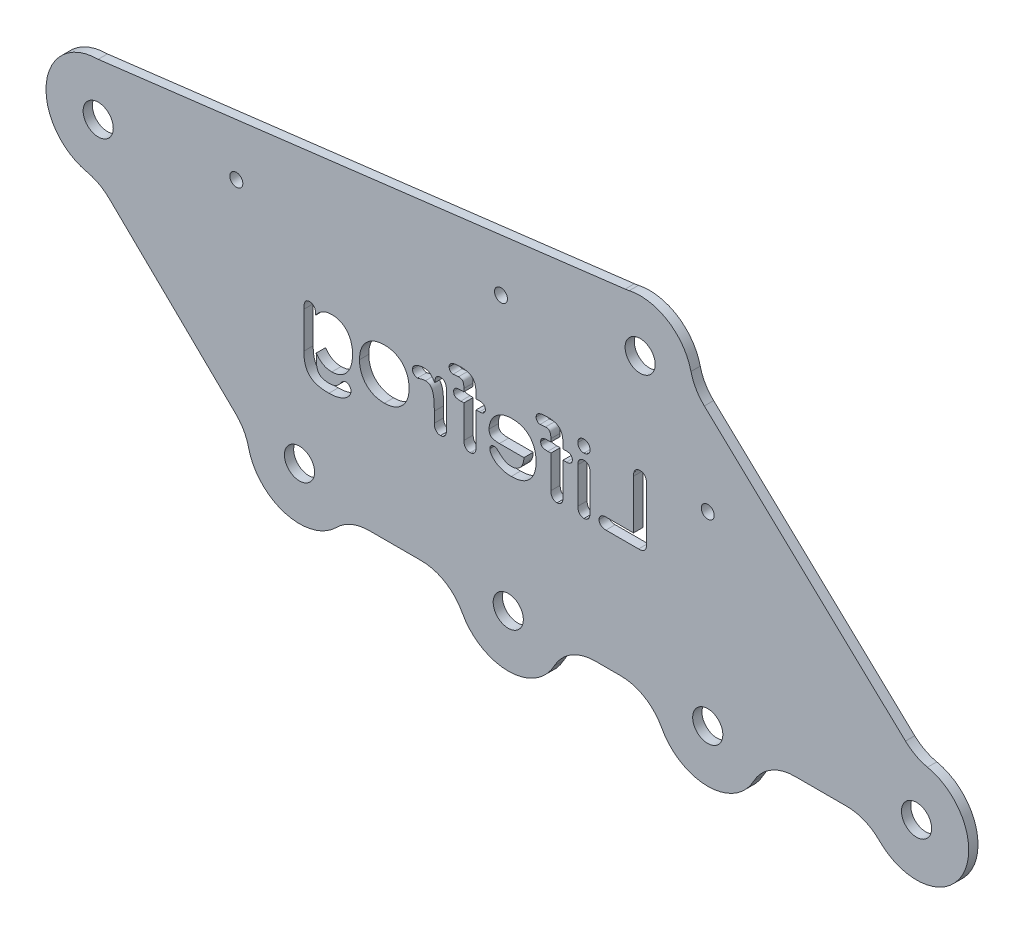
from build123d import *

# Parameters (mm, degrees)
SKETCH2_R           = 3.25
BOSS_EXTRUDE1_DEPTH = 2
SKETCH7_R           = 1.4
CUT_EXTRUDE4_DEPTH  = 173.081521917
CUT_EXTRUDE5_DEPTH  = 173.081521917
SKETCH9_R           = 4.424451358
SKETCH9_R_2         = 3.80051452
CUT_EXTRUDE6_DEPTH  = 10


with BuildPart() as part:
    # Sketch2 → Boss-Extrude1 (new body)
    with BuildSketch(Plane.XY):
        with BuildLine():
            Line((-148.073115296, -13.584682462), (-120.825231203, -40.096785488))
            ThreePointArc((-120.825231203, -40.096785488), (-119.081817876, -42.363650366), (-118.051299446, -45.031270685))
            ThreePointArc((-118.051299446, -45.031270685), (-110.186182808, -53.333696022), (-99.116582089, -50.460672154))
            ThreePointArc((-99.116582089, -50.460672154), (-95.868116105, -48.284014232), (-92.03329116, -47.519495684))
            Line((-92.03329116, -47.519495684), (-80.835284384, -47.519495684))
            ThreePointArc((-80.835284384, -47.519495684), (-75.69032683, -48.944566427), (-72.011754972, -52.813613331))
            ThreePointArc((-72.011754972, -52.813613331), (-62.085284384, -58.769495684), (-52.158813796, -52.813613331))
            ThreePointArc((-52.158813796, -52.813613331), (-48.480241938, -48.944566427), (-43.335284384, -47.519495684))
            Line((-43.335284384, -47.519495684), (-37.835284384, -47.519495684))
            ThreePointArc((-37.835284384, -47.519495684), (-32.69032683, -48.944566427), (-29.011754972, -52.813613331))
            ThreePointArc((-29.011754972, -52.813613331), (-19.085284384, -58.769495684), (-9.158813796, -52.813613331))
            ThreePointArc((-9.158813796, -52.813613331), (-5.480241938, -48.944566427), (-0.335284384, -47.519495684))
            Line((-0.335284384, -47.519495684), (10.862722393, -47.519495684))
            ThreePointArc((10.862722393, -47.519495684), (14.697547337, -48.284014232), (17.946013321, -50.460672154))
            ThreePointArc((17.946013321, -50.460672154), (35.789142951, -47.910060108), (28.284854849, -31.521998695))
            ThreePointArc((28.284854849, -31.521998695), (25.737103371, -30.597165541), (23.531291017, -29.022127188))
            Line((23.531291017, -29.022127188), (-19.826212646, 11.860344126))
            ThreePointArc((-19.826212646, 11.860344126), (-21.632423973, 14.14697339), (-22.70275091, 16.857226699))
            ThreePointArc((-22.70275091, 16.857226699), (-27.630580825, 23.793458302), (-36.00543315, 25.295678347))
            ThreePointArc((-36.00543315, 25.295678347), (-36.440399397, 25.212847446), (-36.878605966, 25.149352578))
            Line((-36.878605966, 25.149352578), (-150.472591379, 11.25))
            ThreePointArc((-150.472591379, 11.25), (-161.656466294, 1.217966296), (-152.894206081, -10.986276996))
            ThreePointArc((-152.894206081, -10.986276996), (-150.302310001, -11.949001015), (-148.073115296, -13.584682462))
        make_face()
        with Locations((25.914715616, -42.519495684)):
            Circle(SKETCH2_R, mode=Mode.SUBTRACT)
        with Locations((-19.085284384, -47.519495684)):
            Circle(SKETCH2_R, mode=Mode.SUBTRACT)
        with Locations((-62.085284384, -47.519495684)):
            Circle(SKETCH2_R, mode=Mode.SUBTRACT)
        with Locations((-107.085284384, -42.519495684)):
            Circle(SKETCH2_R, mode=Mode.SUBTRACT)
        with Locations((-150.472591379, 0)):
            Circle(SKETCH2_R, mode=Mode.SUBTRACT)
        with Locations((-33.656755, 14.29357805)):
            Circle(SKETCH2_R, mode=Mode.SUBTRACT)
    extrude(amount=BOSS_EXTRUDE1_DEPTH)

    # Sketch7 → Cut-Extrude4 (cut, through all)
    with BuildSketch(Plane.XY.offset(2)):
        with Locations((-120.694679945, 3.643623283)):
            Circle(SKETCH7_R)
        with Locations((-63.656755, 10.622780025)):
            Circle(SKETCH7_R)
        with Locations((-19.085284384, -7.519495684)):
            Circle(SKETCH7_R)
    extrude(amount=-CUT_EXTRUDE4_DEPTH, mode=Mode.SUBTRACT)

    # Sketch8 → Cut-Extrude5 (cut, through all)
    # profile 1 of 9: a face of its own
    with BuildSketch(Plane(origin=(0, 0, 0), x_dir=(-1, 0, 0), z_dir=(0, 0, -1))):
        with BuildLine():
            Line((35.086320726, -8.88917677), (35.086320726, -19.477067395))
            Line((35.086320726, -19.477067395), (41.039445726, -19.477067395))
            add(Edge.make_bspline(
                [(41.039445726, -19.477067395), (41.151207657, -19.479993195), (41.364330782, -19.485572515), (41.662298188, -19.554542719), (41.923339942, -19.661257744), (42.134401002, -19.819951832), (42.304522289, -20.005566477), (42.428077526, -20.217869304), (42.500347045, -20.454899643), (42.50877144, -20.620129964), (42.513078539, -20.704606457)],
                knots=[0, 0, 0, 0, 1.240270116, 2.365118784, 3.381765818, 4.352609133, 5.275186246, 6.165500839, 7.062084633, 8, 8, 8, 8], degree=3))
            add(Edge.make_bspline(
                [(42.513078539, -20.704606457), (42.508946769, -20.791061883), (42.500954328, -20.958300126), (42.427991131, -21.197153566), (42.305901504, -21.407864411), (42.137936653, -21.589554136), (41.927138947, -21.739731647), (41.667288952, -21.839448431), (41.367976859, -21.905877279), (41.153144472, -21.911559901), (41.039445726, -21.914567395)],
                knots=[0, 0, 0, 0, 0.961785517, 1.860465312, 2.752861249, 3.654173772, 4.599371787, 5.609990076, 6.735101654, 8, 8, 8, 8], degree=3))
            Line((41.039445726, -21.914567395), (33.996476976, -21.914567395))
            add(Edge.make_bspline(
                [(33.996476976, -21.914567395), (33.853353838, -21.910822677), (33.586803908, -21.903848583), (33.219164265, -21.820051925), (32.910084712, -21.691568649), (32.663815683, -21.496286799), (32.482305295, -21.2361672), (32.358100514, -20.915092293), (32.287886266, -20.530846545), (32.278723904, -20.25471837), (32.273820726, -20.106950207)],
                knots=[0, 0, 0, 0, 1.184943227, 2.206816713, 3.109923682, 3.939837529, 4.776053014, 5.71019795, 6.774627611, 8, 8, 8, 8], degree=3))
            Line((32.273820726, -20.106950207), (32.273820726, -8.88917677))
            add(Edge.make_bspline(
                [(32.273820726, -8.88917677), (32.277444522, -8.749162056), (32.284268854, -8.485486372), (32.356957437, -8.118037422), (32.476634418, -7.804802622), (32.645141816, -7.546892469), (32.856855173, -7.348035389), (33.099081612, -7.202614303), (33.373976884, -7.118889739), (33.566226734, -7.107793002), (33.665422289, -7.102067395)],
                knots=[0, 0, 0, 0, 1.312227502, 2.471186598, 3.495416453, 4.440711492, 5.33513045, 6.197779038, 7.0701043, 8, 8, 8, 8], degree=3))
            add(Edge.make_bspline(
                [(33.665422289, -7.102067395), (33.766728298, -7.106162598), (33.963485083, -7.114116312), (34.241681246, -7.204196573), (34.491196095, -7.34317393), (34.705487503, -7.541754535), (34.882515406, -7.795771782), (35.002902616, -8.111096688), (35.076257378, -8.481501141), (35.082815622, -8.747181708), (35.086320726, -8.88917677)],
                knots=[0, 0, 0, 0, 0.937651975, 1.821110013, 2.686129292, 3.571911612, 4.510265029, 5.535848738, 6.683015045, 8, 8, 8, 8], degree=3))
        make_face()
    # profile 2 of 9: a face of its own
    with BuildSketch(Plane(origin=(0, 0, 0), x_dir=(-1, 0, 0), z_dir=(0, 0, -1))):
        with BuildLine():
            Line((47.086320726, -12.74464552), (47.086320726, -20.476090832))
            add(Edge.make_bspline(
                [(47.086320726, -20.476090832), (47.082420593, -20.602435528), (47.075064066, -20.84074997), (47.005182236, -21.174236118), (46.88809835, -21.460321774), (46.722706311, -21.694972614), (46.519526295, -21.876468441), (46.28964053, -22.009165841), (46.031653529, -22.087195916), (45.85149376, -22.097028675), (45.759172289, -22.102067395)],
                knots=[0, 0, 0, 0, 1.279660949, 2.41372764, 3.434282009, 4.393028164, 5.297478756, 6.175532382, 7.06506577, 8, 8, 8, 8], degree=3))
            add(Edge.make_bspline(
                [(45.759172289, -22.102067395), (45.666704772, -22.097531408), (45.487838174, -22.08875712), (45.23365211, -22.004912745), (45.006451484, -21.871389965), (44.811013414, -21.682373157), (44.650959039, -21.445866625), (44.541087672, -21.160395096), (44.473171135, -20.832780478), (44.465421067, -20.599508451), (44.461320726, -20.476090832)],
                knots=[0, 0, 0, 0, 0.944656094, 1.82731652, 2.710883517, 3.62364324, 4.589202842, 5.612771424, 6.736985008, 8, 8, 8, 8], degree=3))
            Line((44.461320726, -20.476090832), (44.461320726, -12.823747082))
            add(Edge.make_bspline(
                [(44.461320726, -12.823747082), (44.4655151, -12.699382119), (44.473445887, -12.464230884), (44.539697696, -12.136087305), (44.650415089, -11.854229206), (44.811202223, -11.625466775), (45.007817757, -11.44586487), (45.234070933, -11.317596829), (45.488859368, -11.241954113), (45.666855774, -11.232151465), (45.759172289, -11.227067395)],
                knots=[0, 0, 0, 0, 1.282601348, 2.425162879, 3.437763456, 4.38569495, 5.284727511, 6.164859808, 7.048218153, 8, 8, 8, 8], degree=3))
            add(Edge.make_bspline(
                [(45.759172289, -11.227067395), (45.851434596, -11.232364163), (46.031201162, -11.242684541), (46.289294531, -11.316791228), (46.519597684, -11.446472242), (46.719799732, -11.624386887), (46.886864263, -11.846010703), (47.003355814, -12.112795725), (47.074726656, -12.416719887), (47.082335115, -12.631916842), (47.086320726, -12.74464552)],
                knots=[0, 0, 0, 0, 0.975882645, 1.901438153, 2.812865763, 3.75006033, 4.717368935, 5.725761173, 6.808663735, 8, 8, 8, 8], degree=3))
        make_face()
    # profile 3 of 9: a face of its own
    with BuildSketch(Plane(origin=(0, 0, 0), x_dir=(-1, 0, 0), z_dir=(0, 0, -1))):
        with BuildLine():
            add(Edge.make_bspline(
                [(45.788469164, -9.914567395), (45.700155278, -9.911112501), (45.527837589, -9.904371326), (45.279123369, -9.837014704), (45.05142568, -9.726888524), (44.844494731, -9.578448802), (44.672494362, -9.386651845), (44.546452039, -9.154497095), (44.472722475, -8.885778489), (44.46522284, -8.695310105), (44.461320726, -8.59620802)],
                knots=[0, 0, 0, 0, 1.006201835, 1.963296869, 2.915511555, 3.880878732, 4.85189213, 5.829536295, 6.870691953, 8, 8, 8, 8], degree=3))
            add(Edge.make_bspline(
                [(44.461320726, -8.59620802), (44.466503012, -8.504891338), (44.476546269, -8.327919822), (44.551669892, -8.073896193), (44.680826892, -7.848246813), (44.854448523, -7.652100465), (45.060826482, -7.494003153), (45.286053439, -7.371969471), (45.53257688, -7.303278473), (45.702130039, -7.29419357), (45.788469164, -7.289567395)],
                knots=[0, 0, 0, 0, 1.057408726, 2.04925565, 3.037480321, 4.047814229, 5.064214746, 6.036169889, 6.999986943, 8, 8, 8, 8], degree=3))
            add(Edge.make_bspline(
                [(45.788469164, -7.289567395), (45.871883282, -7.293289281), (46.035245133, -7.300578386), (46.272968232, -7.365176401), (46.494233713, -7.471719022), (46.696092474, -7.61868617), (46.874547315, -7.801949122), (46.996351464, -8.035133325), (47.076989401, -8.302838261), (47.083100242, -8.494958443), (47.086320726, -8.59620802)],
                knots=[0, 0, 0, 0, 0.967133894, 1.894077239, 2.837452275, 3.803721558, 4.782485793, 5.777084342, 6.828497526, 8, 8, 8, 8], degree=3))
            add(Edge.make_bspline(
                [(47.086320726, -8.59620802), (47.082548229, -8.694407685), (47.075299369, -8.883098506), (46.999769728, -9.148438196), (46.878868744, -9.381879948), (46.705206821, -9.571319036), (46.504492812, -9.722899361), (46.282136483, -9.833786351), (46.041845864, -9.904963009), (45.873933033, -9.911327839), (45.788469164, -9.914567395)],
                knots=[0, 0, 0, 0, 1.133982342, 2.178948973, 3.165031597, 4.149752721, 5.126395816, 6.06160272, 7.013399203, 8, 8, 8, 8], degree=3))
        make_face()
    # profile 4 of 9: a face of its own
    with BuildSketch(Plane(origin=(0, 0, 0), x_dir=(-1, 0, 0), z_dir=(0, 0, -1))):
        with BuildLine():
            Line((49.632219164, -11.414567395), (50.273820726, -11.414567395))
            Line((50.273820726, -11.414567395), (50.273820726, -10.591325207))
            add(Edge.make_bspline(
                [(50.273820726, -10.591325207), (50.277514056, -10.388045332), (50.284509589, -10.00301306), (50.342549558, -9.457909943), (50.436641901, -8.978381027), (50.569332837, -8.557808501), (50.755633772, -8.195572563), (50.996610195, -7.887535194), (51.293777818, -7.633608774), (51.648730133, -7.431434885), (52.067068931, -7.280410479), (52.552532894, -7.174729198), (53.108091552, -7.111487828), (53.502156344, -7.105323868), (53.710344164, -7.102067395)],
                knots=[0, 0, 0, 0, 1.272338929, 2.409936283, 3.426662608, 4.327577154, 5.161578725, 5.96266415, 6.760383261, 7.592994418, 8.506024445, 9.533847079, 10.697110196, 12, 12, 12, 12], degree=3))
            add(Edge.make_bspline(
                [(53.710344164, -7.102067395), (53.895146779, -7.104261268), (54.241413904, -7.108371958), (54.723647309, -7.168286024), (55.135762658, -7.255167266), (55.473032061, -7.391161667), (55.744889456, -7.558653085), (55.937764712, -7.776533401), (56.05427242, -8.037027657), (56.067659952, -8.223910447), (56.074601976, -8.320817395)],
                knots=[0, 0, 0, 0, 1.495564663, 2.802259462, 3.930374803, 4.895312065, 5.735498063, 6.492167842, 7.218122695, 8, 8, 8, 8], degree=3))
            add(Edge.make_bspline(
                [(56.074601976, -8.320817395), (56.07205453, -8.384563693), (56.067042815, -8.509974928), (56.019565864, -8.690669099), (55.937272087, -8.855101057), (55.831089458, -9.002344218), (55.703605103, -9.125761707), (55.560931421, -9.215318606), (55.405925119, -9.272564588), (55.297752865, -9.278650351), (55.242570726, -9.281754895)],
                knots=[0, 0, 0, 0, 1.08569999, 2.135951137, 3.156332465, 4.20565892, 5.218674748, 6.161348951, 7.062045096, 8, 8, 8, 8], degree=3))
            add(Edge.make_bspline(
                [(55.242570726, -9.281754895), (55.211291096, -9.281243662), (55.139763808, -9.280074624), (55.017892004, -9.265550853), (54.867145158, -9.249871502), (54.639618335, -9.213428957), (54.363834674, -9.175272517), (54.14601204, -9.167906783), (54.047258226, -9.164567395)],
                knots=[0, 0, 0, 0, 0.468218035, 1.070676523, 1.83620524, 2.737967929, 4.521099009, 6, 6, 6, 6], degree=3))
            add(Edge.make_bspline(
                [(54.047258226, -9.164567395), (53.935335203, -9.168513751), (53.730509601, -9.175735811), (53.453388449, -9.253609551), (53.236438618, -9.387787922), (53.093840565, -9.587280743), (53.00705741, -9.82836939), (52.94477266, -10.108223991), (52.902635068, -10.432859402), (52.900145328, -10.66441903), (52.898820726, -10.78761427)],
                knots=[0, 0, 0, 0, 1.158634456, 2.120368021, 2.955008234, 3.751380872, 4.611223429, 5.599229928, 6.722733105, 8, 8, 8, 8], degree=3))
            Line((52.898820726, -10.78761427), (52.898820726, -11.414567395))
            Line((52.898820726, -11.414567395), (53.563859789, -11.414567395))
            add(Edge.make_bspline(
                [(53.563859789, -11.414567395), (53.684179087, -11.416649074), (53.910242779, -11.420560268), (54.225792592, -11.467875581), (54.49621768, -11.540251074), (54.718209635, -11.648680399), (54.893566863, -11.789413733), (55.016660753, -11.965226471), (55.094330745, -12.172143548), (55.10125483, -12.32106946), (55.104875414, -12.398942395)],
                knots=[0, 0, 0, 0, 1.396050608, 2.622990337, 3.6962846, 4.634546857, 5.472373731, 6.277878481, 7.09950757, 8, 8, 8, 8], degree=3))
            add(Edge.make_bspline(
                [(55.104875414, -12.398942395), (55.100784732, -12.506003658), (55.0933337, -12.701011923), (55.017531846, -12.965095468), (54.888175636, -13.171513058), (54.692271136, -13.302589493), (54.461307669, -13.37783369), (54.196374468, -13.437731598), (53.892808985, -13.470942071), (53.677213775, -13.474956644), (53.563859789, -13.477067395)],
                knots=[0, 0, 0, 0, 1.171181197, 2.133264703, 2.982673099, 3.781862637, 4.659228062, 5.636037739, 6.757094158, 8, 8, 8, 8], degree=3))
            Line((53.563859789, -13.477067395), (52.898820726, -13.477067395))
            Line((52.898820726, -13.477067395), (52.898820726, -20.49073927))
            add(Edge.make_bspline(
                [(52.898820726, -20.49073927), (52.894890647, -20.614179922), (52.887425469, -20.848655192), (52.816934516, -21.176561155), (52.703366177, -21.461585314), (52.538062875, -21.695052259), (52.335369862, -21.875428653), (52.106713482, -22.010618694), (51.846897908, -22.086940159), (51.664920121, -22.096942211), (51.571672289, -22.102067395)],
                knots=[0, 0, 0, 0, 1.256538349, 2.386792053, 3.399650087, 4.363398215, 5.272567509, 6.146574889, 7.050280375, 8, 8, 8, 8], degree=3))
            add(Edge.make_bspline(
                [(51.571672289, -22.102067395), (51.482224977, -22.09710813), (51.307699782, -22.087431855), (51.057160741, -22.007724342), (50.831657988, -21.876461922), (50.631448396, -21.694722042), (50.469647741, -21.460721404), (50.355528177, -21.176665365), (50.285268804, -20.8486244), (50.277769023, -20.614169302), (50.273820726, -20.49073927)],
                knots=[0, 0, 0, 0, 0.920542794, 1.796117823, 2.680158831, 3.592296685, 4.561321835, 5.585807508, 6.729036556, 8, 8, 8, 8], degree=3))
            Line((50.273820726, -20.49073927), (50.273820726, -13.477067395))
            Line((50.273820726, -13.477067395), (49.532609789, -13.477067395))
            add(Edge.make_bspline(
                [(49.532609789, -13.477067395), (49.437497333, -13.474545828), (49.257144996, -13.469764431), (49.004612129, -13.411306638), (48.782055088, -13.326305771), (48.598641031, -13.197615767), (48.451306666, -13.041843238), (48.352045043, -12.858126156), (48.285842232, -12.656347119), (48.279207657, -12.513757181), (48.275773851, -12.43995802)],
                knots=[0, 0, 0, 0, 1.239726906, 2.350771435, 3.369360947, 4.331849643, 5.252604265, 6.143447782, 7.039118766, 8, 8, 8, 8], degree=3))
            add(Edge.make_bspline(
                [(48.275773851, -12.43995802), (48.278931014, -12.359364997), (48.28493967, -12.205981751), (48.351465421, -11.99217143), (48.459813646, -11.809230275), (48.613188222, -11.659732473), (48.810357544, -11.547566221), (49.047458479, -11.470404208), (49.325403123, -11.419710271), (49.525517403, -11.416355939), (49.632219164, -11.414567395)],
                knots=[0, 0, 0, 0, 0.995382564, 1.894394861, 2.740686784, 3.604514537, 4.515167111, 5.524921804, 6.68027808, 8, 8, 8, 8], degree=3))
        make_face()
    # profile 5 of 9: a face of its own
    with BuildSketch(Plane(origin=(0, 0, 0), x_dir=(-1, 0, 0), z_dir=(0, 0, -1))):
        with BuildLine():
            Line((63.993547289, -17.227067395), (58.711320726, -17.227067395))
            add(Edge.make_bspline(
                [(58.711320726, -17.227067395), (58.716485938, -17.373895282), (58.726607174, -17.661604604), (58.802714884, -18.07799563), (58.915860462, -18.469071713), (59.073647335, -18.829619398), (59.270554735, -19.153364248), (59.492765404, -19.442705533), (59.750507136, -19.684973297), (60.03645821, -19.88267243), (60.345770403, -20.033615445), (60.670482904, -20.148105778), (61.01253608, -20.212156224), (61.245255038, -20.222066531), (61.362687914, -20.227067395)],
                knots=[0, 0, 0, 0, 1.179639705, 2.311504614, 3.392005435, 4.44652888, 5.46432702, 6.431680492, 7.370191764, 8.295643874, 9.215452015, 10.129041871, 11.055891293, 12, 12, 12, 12], degree=3))
            add(Edge.make_bspline(
                [(61.362687914, -20.227067395), (61.517315025, -20.221290078), (61.81522082, -20.210159454), (62.248320892, -20.128402077), (62.65037596, -19.976572402), (63.029981243, -19.770423211), (63.382588562, -19.521193305), (63.667016112, -19.296133613), (63.89432751, -19.094787244), (64.085795058, -18.918875484), (64.304668367, -18.722900775), (64.455732274, -18.581855292), (64.535539476, -18.507340832)],
                knots=[0, 0, 0, 0, 1.247905556, 2.404224554, 3.538983975, 4.702801183, 5.881313568, 7.020008393, 7.628790321, 8.331868978, 9.11872483, 10, 10, 10, 10], degree=3))
            add(Edge.make_bspline(
                [(64.535539476, -18.507340832), (64.572653698, -18.48027204), (64.649909263, -18.423926662), (64.791469612, -18.369543996), (64.954050743, -18.338198915), (65.069560502, -18.333846809), (65.130266039, -18.331559582)],
                knots=[0, 0, 0, 0, 0.868866131, 1.808598965, 2.848320883, 4, 4, 4, 4], degree=3))
            add(Edge.make_bspline(
                [(65.130266039, -18.331559582), (65.197009882, -18.333900139), (65.324294385, -18.33836372), (65.504066974, -18.385198991), (65.666679189, -18.453914722), (65.804779268, -18.559309462), (65.921073021, -18.686697731), (66.001439392, -18.843467551), (66.053282091, -19.021621344), (66.057023071, -19.149522649), (66.058976976, -19.216325207)],
                knots=[0, 0, 0, 0, 1.102465736, 2.102468148, 3.057950005, 4.00546365, 4.956145095, 5.889200524, 6.897534264, 8, 8, 8, 8], degree=3))
            add(Edge.make_bspline(
                [(66.058976976, -19.216325207), (66.055140543, -19.281058441), (66.047007822, -19.418284177), (65.990684139, -19.630580971), (65.89753, -19.856403047), (65.771680317, -20.095129398), (65.612344825, -20.341196211), (65.409653802, -20.580823639), (65.174931597, -20.819411181), (64.902221637, -21.049528185), (64.595344086, -21.269822809), (64.249335099, -21.470546591), (63.864239991, -21.646257285), (63.446257949, -21.809324299), (62.992864569, -21.941257019), (62.504327356, -22.0333954), (61.984342492, -22.094193404), (61.625563625, -22.099400308), (61.441789476, -22.102067395)],
                knots=[0, 0, 0, 0, 0.525537938, 1.114069654, 1.772306998, 2.506549159, 3.302753817, 4.147512317, 5.050313588, 6.017967943, 7.041213872, 8.114344659, 9.260276936, 10.47524946, 11.755151616, 13.087980653, 14.508401902, 16, 16, 16, 16], degree=3))
            add(Edge.make_bspline(
                [(61.441789476, -22.102067395), (61.231648736, -22.097519737), (60.821964685, -22.088653761), (60.226784289, -22.021353682), (59.669210967, -21.908362258), (59.150569744, -21.745772772), (58.667513306, -21.542562166), (58.224053508, -21.288395048), (57.820679107, -20.987522623), (57.455460166, -20.64373407), (57.134442572, -20.257975864), (56.850340149, -19.841633038), (56.616330833, -19.388813691), (56.421842234, -18.905299727), (56.270116103, -18.389217889), (56.162139879, -17.840151988), (56.09676424, -17.258936562), (56.089857706, -16.86005426), (56.086320726, -16.655778332)],
                knots=[0, 0, 0, 0, 1.161895415, 2.265196273, 3.307380836, 4.303185105, 5.266158709, 6.199917451, 7.122316156, 8.043005893, 8.966794753, 9.89246016, 10.824859252, 11.779559524, 12.770652002, 13.794812853, 14.87067777, 16, 16, 16, 16], degree=3))
            add(Edge.make_bspline(
                [(56.086320726, -16.655778332), (56.089863596, -16.462226663), (56.096844531, -16.080848933), (56.163955879, -15.519624607), (56.268451373, -14.979723953), (56.413728423, -14.462108781), (56.604168314, -13.975533109), (56.829293377, -13.519340339), (57.098097208, -13.102077052), (57.402287332, -12.718106315), (57.750981266, -12.376213514), (58.140980683, -12.074737303), (58.573216423, -11.817183613), (59.045085371, -11.603132446), (59.551427203, -11.433045112), (60.089833345, -11.315293392), (60.656383848, -11.238702527), (61.044069017, -11.231007425), (61.242570726, -11.227067395)],
                knots=[0, 0, 0, 0, 1.095507523, 2.15860795, 3.195309999, 4.206995944, 5.197887526, 6.149926361, 7.082497361, 8.003040645, 8.917987058, 9.840388418, 10.787726911, 11.760164811, 12.769081724, 13.806049167, 14.876658106, 16, 16, 16, 16], degree=3))
            add(Edge.make_bspline(
                [(61.242570726, -11.227067395), (61.372538981, -11.22810589), (61.627045231, -11.23013949), (62.001408011, -11.265268194), (62.362503375, -11.313850777), (62.710727077, -11.382379075), (63.04253843, -11.478141357), (63.361054388, -11.589179566), (63.666118712, -11.720379466), (63.955121946, -11.874248291), (64.230989577, -12.038773815), (64.485024674, -12.223475089), (64.726773861, -12.411434191), (64.947774364, -12.616494045), (65.15303199, -12.831425773), (65.33677691, -13.06140635), (65.506460871, -13.299708893), (65.701149201, -13.632045496), (65.90499798, -14.058699678), (66.086744263, -14.582630241), (66.196585792, -15.115069491), (66.210329972, -15.472667779), (66.217180101, -15.65089552)],
                knots=[0, 0, 0, 0, 1.048847282, 2.053872234, 3.03283051, 3.989924751, 4.915857681, 5.818505585, 6.711913066, 7.593554535, 8.460263899, 9.302531452, 10.127499996, 10.930978608, 11.734070318, 12.524563272, 13.305443929, 14.093732096, 15.631266151, 17.114748765, 18.561984696, 20, 20, 20, 20], degree=3))
            add(Edge.make_bspline(
                [(66.217180101, -15.65089552), (66.215610952, -15.730068621), (66.212617901, -15.881086234), (66.186937014, -16.097314554), (66.140772023, -16.291180146), (66.075053252, -16.464024902), (65.995488051, -16.617172785), (65.89278487, -16.74579461), (65.773975455, -16.854326494), (65.582181996, -16.968584464), (65.300769745, -17.07492862), (64.916543956, -17.164445981), (64.474589043, -17.219117531), (64.159728488, -17.224321026), (63.993547289, -17.227067395)],
                knots=[0, 0, 0, 0, 0.899856074, 1.716417764, 2.470354694, 3.159019517, 3.814679391, 4.423252287, 5.02068589, 5.633798556, 6.949059873, 8.421953477, 10.111532063, 12, 12, 12, 12], degree=3))
        make_face()
        with BuildLine():
            Line((58.711320726, -15.727067395), (63.606828539, -15.727067395))
            add(Edge.make_bspline(
                [(63.606828539, -15.727067395), (63.597892017, -15.620388862), (63.580506578, -15.412852503), (63.525243597, -15.113999216), (63.460289426, -14.835108466), (63.374142884, -14.577543089), (63.272543011, -14.341165405), (63.154505162, -14.123236857), (63.017386306, -13.928050969), (62.863841728, -13.753386376), (62.694974951, -13.600302554), (62.514511391, -13.465060191), (62.318539721, -13.352382039), (62.109343802, -13.262997606), (61.88971522, -13.187447347), (61.65522259, -13.140138129), (61.409640164, -13.105158478), (61.240753138, -13.103110926), (61.154680101, -13.102067395)],
                knots=[0, 0, 0, 0, 1.274652096, 2.479755284, 3.617009281, 4.684005428, 5.71065458, 6.679155714, 7.63137599, 8.546404667, 9.444107911, 10.342338794, 11.228430864, 12.129821099, 13.049645363, 13.989847955, 14.975528821, 16, 16, 16, 16], degree=3))
            add(Edge.make_bspline(
                [(61.154680101, -13.102067395), (61.072577515, -13.10475237), (60.911762666, -13.110011447), (60.674960792, -13.138599654), (60.450175128, -13.191199261), (60.236485897, -13.265652746), (60.033877273, -13.359118289), (59.842432731, -13.474146939), (59.662756958, -13.609700616), (59.495375907, -13.766189336), (59.339368932, -13.941320054), (59.201880517, -14.138573533), (59.081832188, -14.355594311), (58.972348183, -14.589561112), (58.881951346, -14.845787112), (58.809840485, -15.122470817), (58.750931011, -15.417941176), (58.724734593, -15.622383021), (58.711320726, -15.727067395)],
                knots=[0, 0, 0, 0, 0.988988761, 1.937138454, 2.867098831, 3.763434994, 4.657917626, 5.549380048, 6.447873833, 7.363218941, 8.304708192, 9.267190604, 10.251834605, 11.288414524, 12.374576878, 13.518478699, 14.729337904, 16, 16, 16, 16], degree=3))
        make_face(mode=Mode.SUBTRACT)
    # profile 6 of 9: a face of its own
    with BuildSketch(Plane(origin=(0, 0, 0), x_dir=(-1, 0, 0), z_dir=(0, 0, -1))):
        with BuildLine():
            Line((68.382219164, -11.414567395), (69.023820726, -11.414567395))
            Line((69.023820726, -11.414567395), (69.023820726, -10.591325207))
            add(Edge.make_bspline(
                [(69.023820726, -10.591325207), (69.027514056, -10.388045332), (69.034509589, -10.00301306), (69.092549558, -9.457909943), (69.186641901, -8.978381027), (69.319332837, -8.557808501), (69.505633772, -8.195572563), (69.746610195, -7.887535194), (70.043777818, -7.633608774), (70.398730133, -7.431434885), (70.817068931, -7.280410479), (71.302532894, -7.174729198), (71.858091552, -7.111487828), (72.252156344, -7.105323868), (72.460344164, -7.102067395)],
                knots=[0, 0, 0, 0, 1.272338929, 2.409936283, 3.426662608, 4.327577154, 5.161578725, 5.96266415, 6.760383261, 7.592994418, 8.506024445, 9.533847079, 10.697110196, 12, 12, 12, 12], degree=3))
            add(Edge.make_bspline(
                [(72.460344164, -7.102067395), (72.645146779, -7.104261268), (72.991413904, -7.108371958), (73.473647309, -7.168286024), (73.885762658, -7.255167266), (74.223032061, -7.391161667), (74.494889456, -7.558653085), (74.687764712, -7.776533401), (74.80427242, -8.037027657), (74.817659952, -8.223910447), (74.824601976, -8.320817395)],
                knots=[0, 0, 0, 0, 1.495564663, 2.802259462, 3.930374803, 4.895312065, 5.735498063, 6.492167842, 7.218122695, 8, 8, 8, 8], degree=3))
            add(Edge.make_bspline(
                [(74.824601976, -8.320817395), (74.82205453, -8.384563693), (74.817042815, -8.509974928), (74.769565864, -8.690669099), (74.687272087, -8.855101057), (74.581089458, -9.002344218), (74.453605103, -9.125761707), (74.310931421, -9.215318606), (74.155925119, -9.272564588), (74.047752865, -9.278650351), (73.992570726, -9.281754895)],
                knots=[0, 0, 0, 0, 1.08569999, 2.135951137, 3.156332465, 4.20565892, 5.218674748, 6.161348951, 7.062045096, 8, 8, 8, 8], degree=3))
            add(Edge.make_bspline(
                [(73.992570726, -9.281754895), (73.961291096, -9.281243662), (73.889763808, -9.280074624), (73.767892004, -9.265550853), (73.617145158, -9.249871502), (73.389618335, -9.213428957), (73.113834674, -9.175272517), (72.89601204, -9.167906783), (72.797258226, -9.164567395)],
                knots=[0, 0, 0, 0, 0.468218035, 1.070676523, 1.83620524, 2.737967929, 4.521099009, 6, 6, 6, 6], degree=3))
            add(Edge.make_bspline(
                [(72.797258226, -9.164567395), (72.685335203, -9.168513751), (72.480509601, -9.175735811), (72.203388449, -9.253609551), (71.986438618, -9.387787922), (71.843840565, -9.587280743), (71.75705741, -9.82836939), (71.69477266, -10.108223991), (71.652635068, -10.432859402), (71.650145328, -10.66441903), (71.648820726, -10.78761427)],
                knots=[0, 0, 0, 0, 1.158634456, 2.120368021, 2.955008234, 3.751380872, 4.611223429, 5.599229928, 6.722733105, 8, 8, 8, 8], degree=3))
            Line((71.648820726, -10.78761427), (71.648820726, -11.414567395))
            Line((71.648820726, -11.414567395), (72.313859789, -11.414567395))
            add(Edge.make_bspline(
                [(72.313859789, -11.414567395), (72.434179087, -11.416649074), (72.660242779, -11.420560268), (72.975792592, -11.467875581), (73.24621768, -11.540251074), (73.468209635, -11.648680399), (73.643566863, -11.789413733), (73.766660753, -11.965226471), (73.844330745, -12.172143548), (73.85125483, -12.32106946), (73.854875414, -12.398942395)],
                knots=[0, 0, 0, 0, 1.396050608, 2.622990337, 3.6962846, 4.634546857, 5.472373731, 6.277878481, 7.09950757, 8, 8, 8, 8], degree=3))
            add(Edge.make_bspline(
                [(73.854875414, -12.398942395), (73.850784732, -12.506003658), (73.8433337, -12.701011923), (73.767531846, -12.965095468), (73.638175636, -13.171513058), (73.442271136, -13.302589493), (73.211307669, -13.37783369), (72.946374468, -13.437731598), (72.642808985, -13.470942071), (72.427213775, -13.474956644), (72.313859789, -13.477067395)],
                knots=[0, 0, 0, 0, 1.171181197, 2.133264703, 2.982673099, 3.781862637, 4.659228062, 5.636037739, 6.757094158, 8, 8, 8, 8], degree=3))
            Line((72.313859789, -13.477067395), (71.648820726, -13.477067395))
            Line((71.648820726, -13.477067395), (71.648820726, -20.49073927))
            add(Edge.make_bspline(
                [(71.648820726, -20.49073927), (71.644890647, -20.614179922), (71.637425469, -20.848655192), (71.566934516, -21.176561155), (71.453366177, -21.461585314), (71.288062875, -21.695052259), (71.085369862, -21.875428653), (70.856713482, -22.010618694), (70.596897908, -22.086940159), (70.414920121, -22.096942211), (70.321672289, -22.102067395)],
                knots=[0, 0, 0, 0, 1.256538349, 2.386792053, 3.399650087, 4.363398215, 5.272567509, 6.146574889, 7.050280375, 8, 8, 8, 8], degree=3))
            add(Edge.make_bspline(
                [(70.321672289, -22.102067395), (70.232224977, -22.09710813), (70.057699782, -22.087431855), (69.807160741, -22.007724342), (69.581657988, -21.876461922), (69.381448396, -21.694722042), (69.219647741, -21.460721404), (69.105528177, -21.176665365), (69.035268804, -20.8486244), (69.027769023, -20.614169302), (69.023820726, -20.49073927)],
                knots=[0, 0, 0, 0, 0.920542794, 1.796117823, 2.680158831, 3.592296685, 4.561321835, 5.585807508, 6.729036556, 8, 8, 8, 8], degree=3))
            Line((69.023820726, -20.49073927), (69.023820726, -13.477067395))
            Line((69.023820726, -13.477067395), (68.282609789, -13.477067395))
            add(Edge.make_bspline(
                [(68.282609789, -13.477067395), (68.187497333, -13.474545828), (68.007144996, -13.469764431), (67.754612129, -13.411306638), (67.532055088, -13.326305771), (67.348641031, -13.197615767), (67.201306666, -13.041843238), (67.102045043, -12.858126156), (67.035842232, -12.656347119), (67.029207657, -12.513757181), (67.025773851, -12.43995802)],
                knots=[0, 0, 0, 0, 1.239726906, 2.350771435, 3.369360947, 4.331849643, 5.252604265, 6.143447782, 7.039118766, 8, 8, 8, 8], degree=3))
            add(Edge.make_bspline(
                [(67.025773851, -12.43995802), (67.028931014, -12.359364997), (67.03493967, -12.205981751), (67.101465421, -11.99217143), (67.209813646, -11.809230275), (67.363188222, -11.659732473), (67.560357544, -11.547566221), (67.797458479, -11.470404208), (68.075403123, -11.419710271), (68.275517403, -11.416355939), (68.382219164, -11.414567395)],
                knots=[0, 0, 0, 0, 0.995382564, 1.894394861, 2.740686784, 3.604514537, 4.515167111, 5.524921804, 6.68027808, 8, 8, 8, 8], degree=3))
        make_face()
    # profile 7 of 9: a face of its own
    with BuildSketch(Plane(origin=(0, 0, 0), x_dir=(-1, 0, 0), z_dir=(0, 0, -1))):
        with BuildLine():
            Line((78.023820726, -18.21730177), (78.023820726, -20.464372082))
            add(Edge.make_bspline(
                [(78.023820726, -20.464372082), (78.019892411, -20.592663462), (78.012477123, -20.83483283), (77.942998305, -21.173173015), (77.826395379, -21.46268977), (77.660008013, -21.697626109), (77.457891862, -21.879946249), (77.226225762, -22.008518529), (76.969273636, -22.08740627), (76.789034454, -22.097099946), (76.696672289, -22.102067395)],
                knots=[0, 0, 0, 0, 1.292414504, 2.439627698, 3.46375878, 4.417332263, 5.316903122, 6.185375834, 7.070109971, 8, 8, 8, 8], degree=3))
            add(Edge.make_bspline(
                [(76.696672289, -22.102067395), (76.605316881, -22.09710505), (76.427986301, -22.087472609), (76.174585021, -22.009227395), (75.950610673, -21.875274697), (75.750230464, -21.695716107), (75.591715438, -21.458957778), (75.476710712, -21.174115576), (75.410996302, -20.840355995), (75.403041563, -20.602368539), (75.398820726, -20.476090832)],
                knots=[0, 0, 0, 0, 0.933294383, 1.81162385, 2.680186499, 3.585258456, 4.541104918, 5.566887721, 6.708974649, 8, 8, 8, 8], degree=3))
            Line((75.398820726, -20.476090832), (75.398820726, -13.028825207))
            add(Edge.make_bspline(
                [(75.398820726, -13.028825207), (75.402484719, -12.887967816), (75.409365917, -12.623429237), (75.466438734, -12.253599122), (75.562647251, -11.937580399), (75.705960969, -11.678454634), (75.886700953, -11.470839169), (76.115388002, -11.325648529), (76.384574397, -11.24325969), (76.575973652, -11.232631094), (76.676164476, -11.227067395)],
                knots=[0, 0, 0, 0, 1.34619872, 2.528241455, 3.567694465, 4.487339067, 5.340335725, 6.171799567, 7.043000931, 8, 8, 8, 8], degree=3))
            add(Edge.make_bspline(
                [(76.676164476, -11.227067395), (76.778250892, -11.23166171), (76.970074096, -11.240294554), (77.23647969, -11.31618665), (77.457457209, -11.448839438), (77.627712083, -11.63900255), (77.758010721, -11.876050227), (77.852605586, -12.159893812), (77.912208923, -12.492418163), (77.927694018, -12.729745798), (77.935930101, -12.855973645)],
                knots=[0, 0, 0, 0, 1.044883286, 1.963364657, 2.807970932, 3.650974255, 4.547373518, 5.563477854, 6.704082887, 8, 8, 8, 8], degree=3))
            add(Edge.make_bspline(
                [(77.935930101, -12.855973645), (78.015060213, -12.728702257), (78.166410553, -12.485273209), (78.414258837, -12.155879517), (78.661252631, -11.872664951), (78.918064986, -11.635812705), (79.199992654, -11.445181426), (79.525823034, -11.317799074), (79.892305657, -11.240889927), (80.150364302, -11.231818927), (80.285539476, -11.227067395)],
                knots=[0, 0, 0, 0, 1.18924255, 2.274636787, 3.268721947, 4.168850259, 5.041860026, 5.953170485, 6.927838526, 8, 8, 8, 8], degree=3))
            add(Edge.make_bspline(
                [(80.285539476, -11.227067395), (80.426467245, -11.232489358), (80.70936151, -11.243373249), (81.129162593, -11.320929872), (81.541294315, -11.453132582), (81.873448057, -11.600397905), (82.12154417, -11.742608322), (82.286513298, -11.857020394), (82.423463313, -11.98382965), (82.540429583, -12.115426572), (82.630091374, -12.257833616), (82.691453181, -12.409798496), (82.732078243, -12.569674136), (82.735800435, -12.679941298), (82.737687914, -12.735856457)],
                knots=[0, 0, 0, 0, 1.609451603, 3.230765888, 4.857137694, 6.544750347, 7.369389467, 8.121503283, 8.832102741, 9.496362917, 10.127778221, 10.743023735, 11.362602371, 12, 12, 12, 12], degree=3))
            add(Edge.make_bspline(
                [(82.737687914, -12.735856457), (82.734447601, -12.813574254), (82.728170407, -12.9641306), (82.658798765, -13.177988977), (82.553564502, -13.372817877), (82.402963372, -13.536083886), (82.232143043, -13.670264449), (82.04869511, -13.768279515), (81.85786951, -13.830801857), (81.727395914, -13.839133704), (81.662492601, -13.843278332)],
                knots=[0, 0, 0, 0, 1.088483127, 2.10862957, 3.128406662, 4.178128692, 5.204900727, 6.16884502, 7.089102868, 8, 8, 8, 8], degree=3))
            add(Edge.make_bspline(
                [(81.662492601, -13.843278332), (81.629178627, -13.840040056), (81.542984296, -13.831661558), (81.39025665, -13.792022204), (81.183740219, -13.737267753), (80.939095726, -13.659990651), (80.677274642, -13.576472525), (80.415801332, -13.523477689), (80.172440405, -13.484406004), (80.015169718, -13.479444147), (79.939836351, -13.477067395)],
                knots=[0, 0, 0, 0, 0.454029574, 1.174725489, 2.136679894, 3.357464208, 4.658256254, 5.865202561, 6.977422421, 8, 8, 8, 8], degree=3))
            add(Edge.make_bspline(
                [(79.939836351, -13.477067395), (79.845889074, -13.48141761), (79.66407233, -13.489836608), (79.402436427, -13.542788927), (79.170931902, -13.646030446), (78.963806071, -13.78176069), (78.785197235, -13.961357491), (78.627437355, -14.175620461), (78.492532222, -14.42885195), (78.379665037, -14.716376161), (78.288170049, -15.037011302), (78.209419115, -15.386257938), (78.144574547, -15.764579045), (78.099652318, -16.17561647), (78.064172897, -16.623081436), (78.042345893, -17.113612554), (78.02739976, -17.649826852), (78.025046467, -18.022954037), (78.023820726, -18.21730177)],
                knots=[0, 0, 0, 0, 0.794050632, 1.536731085, 2.238662641, 2.922771156, 3.616952249, 4.366019506, 5.163320251, 6.033432924, 6.970572952, 7.977209821, 9.05675488, 10.211001348, 11.468820729, 12.84806026, 14.358274693, 16, 16, 16, 16], degree=3))
        make_face()
    # profile 8 of 9: a face of its own
    with BuildSketch(Plane(origin=(0, 0, 0), x_dir=(-1, 0, 0), z_dir=(0, 0, -1))):
        with BuildLine():
            add(Edge.make_bspline(
                [(94.148820726, -16.67042677), (94.144486428, -16.865958198), (94.135962174, -17.250509443), (94.063694953, -17.815248603), (93.947256433, -18.356735194), (93.783210596, -18.872727585), (93.575555832, -19.359535852), (93.326640268, -19.813005753), (93.033540056, -20.230278447), (92.700172687, -20.609939276), (92.32896808, -20.9531364), (91.919659255, -21.251299839), (91.478131715, -21.51184656), (91.000994931, -21.724708392), (90.492501837, -21.896725611), (89.950942693, -22.014013606), (89.380489134, -22.090278252), (88.989896722, -22.098082029), (88.790422289, -22.102067395)],
                knots=[0, 0, 0, 0, 1.091425222, 2.14650367, 3.173246554, 4.180341516, 5.164818684, 6.123963105, 7.063390915, 8.006199165, 8.940071845, 9.880179878, 10.828459563, 11.797350195, 12.792281962, 13.820196984, 14.886780802, 16, 16, 16, 16], degree=3))
            add(Edge.make_bspline(
                [(88.790422289, -22.102067395), (88.591870928, -22.098480665), (88.203960118, -22.091473252), (87.638922615, -22.010038917), (87.101578123, -21.894122427), (86.597818959, -21.719498742), (86.124926323, -21.501305834), (85.684600318, -21.240748892), (85.277774178, -20.936460383), (84.904876516, -20.593622978), (84.569894039, -20.211571465), (84.277056806, -19.794745386), (84.02509942, -19.345794671), (83.821438064, -18.863747925), (83.658781072, -18.352053245), (83.547410974, -17.811904116), (83.473790099, -17.246665517), (83.465530656, -16.861096277), (83.461320726, -16.664567395)],
                knots=[0, 0, 0, 0, 1.111227023, 2.171009928, 3.19145726, 4.186070048, 5.150303806, 6.104321695, 7.046220171, 7.990735544, 8.936485474, 9.886464991, 10.839039205, 11.814379169, 12.812535149, 13.84133354, 14.899703965, 16, 16, 16, 16], degree=3))
            add(Edge.make_bspline(
                [(83.461320726, -16.664567395), (83.465514225, -16.466082785), (83.473742721, -16.076615619), (83.547624747, -15.505610155), (83.658102464, -14.959085186), (83.824393346, -14.441866346), (84.031384338, -13.954809255), (84.28098393, -13.502415749), (84.569020413, -13.085777538), (84.899270526, -12.708353762), (85.269523718, -12.371342104), (85.67658854, -12.072840001), (86.121373859, -11.818014706), (86.60023799, -11.604092229), (87.110125782, -11.43336561), (87.648459537, -11.31556227), (88.211067148, -11.238923762), (88.594851206, -11.231069711), (88.790422289, -11.227067395)],
                knots=[0, 0, 0, 0, 1.109458584, 2.176983352, 3.214831729, 4.223461232, 5.209438476, 6.170044374, 7.10777617, 8.036608407, 8.968213882, 9.902121437, 10.853822319, 11.829170779, 12.830797886, 13.854949514, 14.906911741, 16, 16, 16, 16], degree=3))
            add(Edge.make_bspline(
                [(88.790422289, -11.227067395), (88.988898872, -11.231174927), (89.378472694, -11.239237275), (89.948439143, -11.31420497), (90.490442677, -11.436140384), (91.001366108, -11.60975716), (91.480472692, -11.827861391), (91.928322675, -12.083355331), (92.33525077, -12.389972109), (92.707032955, -12.732556775), (93.044393285, -13.110969179), (93.333369182, -13.530134072), (93.585085083, -13.980402785), (93.789040515, -14.465390299), (93.949727682, -14.979606196), (94.06772993, -15.519473979), (94.135154052, -16.08667861), (94.144198204, -16.472983807), (94.148820726, -16.67042677)],
                knots=[0, 0, 0, 0, 1.106546112, 2.171950929, 3.199928065, 4.200661522, 5.175688508, 6.132331741, 7.070262582, 8.010799296, 8.948477062, 9.891329305, 10.844648531, 11.82089183, 12.82003801, 13.845645933, 14.898896381, 16, 16, 16, 16], degree=3))
        make_face()
        with BuildLine():
            add(Edge.make_bspline(
                [(91.523820726, -16.67042677), (91.52166415, -16.540471396), (91.517472317, -16.287871443), (91.48242374, -15.920543914), (91.422249062, -15.575532262), (91.347241139, -15.250399141), (91.238347477, -14.950063385), (91.115116448, -14.668872274), (90.959772356, -14.413974861), (90.788871248, -14.178150822), (90.594058889, -13.971012519), (90.386177552, -13.786309146), (90.158198426, -13.634549), (89.916762502, -13.505920097), (89.656972659, -13.41067581), (89.382530068, -13.338976081), (89.091429338, -13.298458846), (88.892104067, -13.292570974), (88.790422289, -13.289567395)],
                knots=[0, 0, 0, 0, 1.270558422, 2.469640054, 3.603049319, 4.693866399, 5.726721989, 6.722451407, 7.690273023, 8.639449843, 9.565088081, 10.465156222, 11.352368502, 12.23649231, 13.133922735, 14.051050542, 15.005782631, 16, 16, 16, 16], degree=3))
            add(Edge.make_bspline(
                [(88.790422289, -13.289567395), (88.659103624, -13.293167537), (88.402886757, -13.300191802), (88.031896286, -13.381687907), (87.682368849, -13.501977975), (87.361299048, -13.680841795), (87.069660153, -13.904384313), (86.809174008, -14.175320472), (86.591638168, -14.498289914), (86.405589523, -14.862686984), (86.265324847, -15.26874037), (86.158586264, -15.706832305), (86.097485862, -16.178473495), (86.090114639, -16.503261048), (86.086320726, -16.67042677)],
                knots=[0, 0, 0, 0, 0.966943267, 1.886610523, 2.788820013, 3.685057501, 4.584069546, 5.490925344, 6.443978365, 7.44584051, 8.500680597, 9.604835001, 10.767226511, 12, 12, 12, 12], degree=3))
            add(Edge.make_bspline(
                [(86.086320726, -16.67042677), (86.089975868, -16.835677251), (86.09707534, -17.156647376), (86.160125836, -17.622697678), (86.260583866, -18.057364566), (86.404461982, -18.457425943), (86.584101967, -18.819204405), (86.804143131, -19.136915148), (87.056381643, -19.412930615), (87.347066752, -19.640114593), (87.667609463, -19.820805111), (88.018399206, -19.946385134), (88.395336031, -20.025112761), (88.656230869, -20.034657865), (88.790422289, -20.039567395)],
                knots=[0, 0, 0, 0, 1.221452891, 2.372458373, 3.470695752, 4.514597835, 5.509283355, 6.448751658, 7.363470559, 8.263476682, 9.165479573, 10.07241203, 11.008543944, 12, 12, 12, 12], degree=3))
            add(Edge.make_bspline(
                [(88.790422289, -20.039567395), (88.892104988, -20.036565161), (89.091432064, -20.030679926), (89.382519836, -19.990143766), (89.657009064, -19.918512142), (89.916630477, -19.823021901), (90.159172029, -19.695037632), (90.385237239, -19.539497593), (90.594238165, -19.355423123), (90.788693162, -19.147917518), (90.960812629, -18.911868837), (91.113426664, -18.65546104), (91.239281777, -18.375603349), (91.346578942, -18.076574149), (91.422386771, -17.753673501), (91.482396805, -17.41152253), (91.517390152, -17.048105533), (91.521641272, -16.798429867), (91.523820726, -16.67042677)],
                knots=[0, 0, 0, 0, 0.996858043, 1.954125933, 2.873689662, 3.773503692, 4.659975762, 5.554937906, 6.457396659, 7.385493423, 8.337191288, 9.315813857, 10.305473609, 11.341072498, 12.425486328, 13.552469893, 14.745206377, 16, 16, 16, 16], degree=3))
        make_face(mode=Mode.SUBTRACT)
    # profile 9 of 9: a face of its own
    with BuildSketch(Plane(origin=(0, 0, 0), x_dir=(-1, 0, 0), z_dir=(0, 0, -1))):
        with BuildLine():
            Line((106.148820726, -13.24855177), (106.148820726, -21.073747082))
            add(Edge.make_bspline(
                [(106.148820726, -21.073747082), (106.145578638, -21.289668532), (106.139304115, -21.707548589), (106.087647215, -22.310838809), (105.997312618, -22.867172203), (105.87222542, -23.377416774), (105.710318638, -23.84506679), (105.498897586, -24.267423187), (105.251306447, -24.653258133), (104.95074422, -24.991966607), (104.608489437, -25.293090564), (104.21162859, -25.544239225), (103.771825619, -25.762432035), (103.278649661, -25.935378901), (102.731346807, -26.064718882), (102.126361775, -26.161485854), (101.458368356, -26.21486082), (100.99266219, -26.222879134), (100.749406664, -26.227067395)],
                knots=[0, 0, 0, 0, 1.193077057, 2.309002223, 3.342578962, 4.304588778, 5.20921544, 6.070806415, 6.909010715, 7.734982653, 8.56501699, 9.419735828, 10.32236431, 11.273091887, 12.300564439, 13.426427611, 14.655728113, 16, 16, 16, 16], degree=3))
            add(Edge.make_bspline(
                [(100.749406664, -26.227067395), (100.523599423, -26.22202945), (100.082375219, -26.212185377), (99.439313286, -26.134772632), (98.833121089, -26.009911299), (98.268330391, -25.836151213), (97.756709712, -25.61584198), (97.297156849, -25.373194016), (96.90504392, -25.092286158), (96.573717183, -24.789883295), (96.315558172, -24.464949316), (96.126441952, -24.133851937), (96.006001323, -23.795706697), (95.990460317, -23.565867789), (95.982805101, -23.452653332)],
                knots=[0, 0, 0, 0, 1.351069114, 2.639970243, 3.869855339, 5.051064834, 6.169170093, 7.199517556, 8.154742545, 9.047991741, 9.875849639, 10.626865665, 11.323619059, 12, 12, 12, 12], degree=3))
            add(Edge.make_bspline(
                [(95.982805101, -23.452653332), (95.986362338, -23.370162444), (95.993247098, -23.210507621), (96.057116047, -22.984868315), (96.157368182, -22.781008156), (96.303861587, -22.611745282), (96.470588202, -22.464836911), (96.665111076, -22.367013987), (96.872932257, -22.299769261), (97.018377877, -22.293031512), (97.093156664, -22.289567395)],
                knots=[0, 0, 0, 0, 1.100593589, 2.130114972, 3.111132825, 4.112532503, 5.103922639, 6.06172617, 7.003464206, 8, 8, 8, 8], degree=3))
            add(Edge.make_bspline(
                [(97.093156664, -22.289567395), (97.187212984, -22.297807486), (97.378139595, -22.314534196), (97.648882696, -22.444243677), (97.896424463, -22.652776613), (98.029590187, -22.834019726), (98.100969164, -22.931168957)],
                knots=[0, 0, 0, 0, 0.904802776, 1.836675377, 2.840423108, 4, 4, 4, 4], degree=3))
            add(Edge.make_bspline(
                [(98.100969164, -22.931168957), (98.175137825, -23.022999385), (98.32511679, -23.208692807), (98.550660272, -23.486189079), (98.794314447, -23.746512382), (99.069278385, -23.974281206), (99.395284902, -24.146027838), (99.772091926, -24.269467496), (100.206663136, -24.341146724), (100.515728119, -24.348291041), (100.679094164, -24.352067395)],
                knots=[0, 0, 0, 0, 0.914657093, 1.849559125, 2.770081465, 3.674097889, 4.601683639, 5.60665287, 6.734920882, 8, 8, 8, 8], degree=3))
            add(Edge.make_bspline(
                [(100.679094164, -24.352067395), (100.845352039, -24.349772775), (101.160483048, -24.345423472), (101.601600038, -24.285053864), (101.987484027, -24.198980643), (102.315356429, -24.065654609), (102.590780708, -23.897104225), (102.822544745, -23.700428003), (103.009718901, -23.473887214), (103.146973543, -23.215432589), (103.2490308, -22.942063458), (103.329376819, -22.657754766), (103.384375905, -22.364576568), (103.411886425, -22.110415408), (103.420846671, -21.891048453), (103.434474931, -21.702786676), (103.442908283, -21.489822304), (103.446736788, -21.254357994), (103.457934273, -20.995690136), (103.462185369, -20.713390218), (103.46845611, -20.407737957), (103.47212331, -20.195818841), (103.474016039, -20.086442395)],
                knots=[0, 0, 0, 0, 1.649040383, 3.12564899, 4.411803224, 5.563945921, 6.621369587, 7.604506927, 8.568970364, 9.519051572, 10.494848921, 11.461599492, 12.448362545, 13.452543324, 13.996197049, 14.627512153, 15.326100287, 16.111569937, 16.965155253, 17.896000539, 18.914076333, 20, 20, 20, 20], degree=3))
            add(Edge.make_bspline(
                [(103.474016039, -20.086442395), (103.369286653, -20.228243024), (103.164348005, -20.505724162), (102.817528696, -20.877376), (102.442844477, -21.192720198), (102.044348908, -21.45735916), (101.614316585, -21.66752994), (101.144288907, -21.808776911), (100.637665064, -21.899353304), (100.285949179, -21.909396738), (100.104875414, -21.914567395)],
                knots=[0, 0, 0, 0, 1.055738715, 2.065911711, 3.03769406, 3.983909981, 4.926118454, 5.894140725, 6.915841209, 8, 8, 8, 8], degree=3))
            add(Edge.make_bspline(
                [(100.104875414, -21.914567395), (99.994441226, -21.912166001), (99.776036181, -21.90741678), (99.454056448, -21.874236458), (99.141308415, -21.822584081), (98.840065478, -21.745500132), (98.548288958, -21.6498829), (98.269175954, -21.527797069), (97.999295761, -21.38790609), (97.740990466, -21.225864527), (97.49518965, -21.04571704), (97.267047943, -20.843687043), (97.047384126, -20.630613496), (96.847523825, -20.395110591), (96.656759723, -20.146190033), (96.489652732, -19.874613587), (96.329534366, -19.590507719), (96.137445139, -19.184568503), (95.938137553, -18.639859379), (95.768966666, -17.942277255), (95.669099205, -17.195772906), (95.655707561, -16.682454565), (95.648820726, -16.418473645)],
                knots=[0, 0, 0, 0, 0.833112071, 1.647640849, 2.439835632, 3.222550966, 3.991445903, 4.753817451, 5.518393315, 6.283004681, 7.052252564, 7.814695319, 8.580583639, 9.358986843, 10.142949644, 10.944274693, 11.762261925, 12.602672888, 14.330023006, 16.127783965, 18.00866038, 20, 20, 20, 20], degree=3))
            add(Edge.make_bspline(
                [(95.648820726, -16.418473645), (95.652642272, -16.221051999), (95.660134445, -15.834005236), (95.722041146, -15.269528036), (95.82493923, -14.734584178), (95.966260416, -14.230525635), (96.152476688, -13.76221528), (96.367793789, -13.327108628), (96.624535766, -12.933618383), (96.912501305, -12.577509314), (97.229367893, -12.259884554), (97.572416193, -11.984063386), (97.938958298, -11.750329511), (98.328110609, -11.559102539), (98.73859142, -11.409212488), (99.170060443, -11.304717183), (99.62033266, -11.237447396), (99.927871945, -11.230568047), (100.084367601, -11.227067395)],
                knots=[0, 0, 0, 0, 1.233131348, 2.417564159, 3.54229185, 4.633406881, 5.682503965, 6.686568855, 7.661289661, 8.611256522, 9.54308529, 10.458735841, 11.355741272, 12.253410383, 13.162451714, 14.079868853, 15.022914474, 16, 16, 16, 16], degree=3))
            add(Edge.make_bspline(
                [(100.084367601, -11.227067395), (100.269315783, -11.232430291), (100.627605237, -11.242819521), (101.14571427, -11.330564927), (101.62709314, -11.467956721), (102.071592609, -11.673662781), (102.49184011, -11.934169427), (102.886423171, -12.266181645), (103.275177029, -12.652319523), (103.504732301, -12.950707472), (103.623430101, -13.104997082)],
                knots=[0, 0, 0, 0, 1.061471399, 2.056327376, 3.009310916, 3.92787468, 4.860034948, 5.84023928, 6.88323694, 8, 8, 8, 8], degree=3))
            Line((103.623430101, -13.104997082), (103.623430101, -12.727067395))
            add(Edge.make_bspline(
                [(103.623430101, -12.727067395), (103.626077546, -12.612313503), (103.631086744, -12.39518899), (103.702722773, -12.091704756), (103.804214345, -11.823343153), (103.960484058, -11.603122273), (104.14437401, -11.422724439), (104.362000974, -11.298828456), (104.601104557, -11.2172405), (104.770200341, -11.210177814), (104.856828539, -11.206559582)],
                knots=[0, 0, 0, 0, 1.247113373, 2.359648813, 3.381150232, 4.352198038, 5.277883478, 6.164782314, 7.059813345, 8, 8, 8, 8], degree=3))
            add(Edge.make_bspline(
                [(104.856828539, -11.206559582), (104.919398777, -11.208373393), (105.039147367, -11.211844711), (105.210376067, -11.234486995), (105.36533458, -11.275276426), (105.503505909, -11.334986164), (105.628592504, -11.406301328), (105.733159003, -11.500628587), (105.821383334, -11.609854306), (105.921728419, -11.781388496), (106.018246955, -12.037350669), (106.092298497, -12.391051336), (106.143763737, -12.800784613), (106.147065006, -13.093092856), (106.148820726, -13.24855177)],
                knots=[0, 0, 0, 0, 0.810834708, 1.551797084, 2.233311032, 2.879728062, 3.498290899, 4.08998989, 4.69281731, 5.311380147, 6.657976162, 8.214589908, 9.986797312, 12, 12, 12, 12], degree=3))
        make_face()
        with BuildLine():
            add(Edge.make_bspline(
                [(98.273820726, -16.60011427), (98.276281556, -16.730047424), (98.281044662, -16.981542019), (98.311655202, -17.347157431), (98.371202048, -17.687645794), (98.450150989, -18.004929454), (98.547119724, -18.300245722), (98.675739383, -18.567527012), (98.820568795, -18.813380932), (98.992902259, -19.030162026), (99.179733998, -19.224261018), (99.38263556, -19.39178449), (99.598998975, -19.533652284), (99.826862156, -19.652126541), (100.070798561, -19.739771747), (100.326009704, -19.803317962), (100.594578391, -19.847388265), (100.778520871, -19.850485666), (100.872453539, -19.852067395)],
                knots=[0, 0, 0, 0, 1.326094944, 2.566748344, 3.739876858, 4.849345108, 5.901987623, 6.905057934, 7.870744796, 8.807773266, 9.724007253, 10.615962186, 11.486673695, 12.360289196, 13.23048723, 14.124833094, 15.042421136, 16, 16, 16, 16], degree=3))
            add(Edge.make_bspline(
                [(100.872453539, -19.852067395), (100.985032624, -19.847129074), (101.208121653, -19.837343196), (101.538167817, -19.771823755), (101.855789615, -19.657505667), (102.165191225, -19.506408219), (102.456515281, -19.30739563), (102.717453893, -19.057934673), (102.952234205, -18.767251673), (103.153003373, -18.431775293), (103.321674171, -18.056411203), (103.44102281, -17.639385406), (103.511456952, -17.184551742), (103.5196042, -16.868929928), (103.523820726, -16.70558302)],
                knots=[0, 0, 0, 0, 0.880139046, 1.744101618, 2.618226241, 3.512817375, 4.4298041, 5.364171231, 6.325232906, 7.342628693, 8.412418537, 9.533532234, 10.723504319, 12, 12, 12, 12], degree=3))
            add(Edge.make_bspline(
                [(103.523820726, -16.70558302), (103.521828321, -16.574619906), (103.51795482, -16.320010232), (103.480555454, -15.949396994), (103.428266274, -15.599848439), (103.34454788, -15.274242485), (103.242674803, -14.969779321), (103.117084696, -14.687598477), (102.96639128, -14.427670741), (102.794428526, -14.191099969), (102.603265332, -13.979670779), (102.398200725, -13.793594575), (102.177028797, -13.636814471), (101.940229913, -13.510556864), (101.690148219, -13.409665), (101.424446708, -13.339618452), (101.144261723, -13.298302832), (100.95267204, -13.292519491), (100.854875414, -13.289567395)],
                knots=[0, 0, 0, 0, 1.287342111, 2.502763926, 3.659965425, 4.759260504, 5.803888242, 6.814004777, 7.790704397, 8.75299419, 9.684461259, 10.588804087, 11.470690333, 12.342850852, 13.221961806, 14.116410723, 15.038525076, 16, 16, 16, 16], degree=3))
            add(Edge.make_bspline(
                [(100.854875414, -13.289567395), (100.75906062, -13.292745672), (100.57252169, -13.298933364), (100.299044703, -13.336677114), (100.041672484, -13.404122728), (99.797230326, -13.498478753), (99.569794689, -13.623115163), (99.352581126, -13.768628456), (99.156446251, -13.948574788), (98.971547222, -14.148675551), (98.807371777, -14.376306837), (98.662718633, -14.626037727), (98.543523384, -14.900966402), (98.443532422, -15.196719787), (98.368464523, -15.515739785), (98.312405714, -15.856255426), (98.280922216, -16.220616918), (98.276234024, -16.471149791), (98.273820726, -16.60011427)],
                knots=[0, 0, 0, 0, 0.970855453, 1.890129187, 2.790031759, 3.660912701, 4.537395663, 5.412817, 6.302655923, 7.22707969, 8.169073145, 9.139777347, 10.145351592, 11.199728276, 12.298788678, 13.461764965, 14.693416344, 16, 16, 16, 16], degree=3))
        make_face(mode=Mode.SUBTRACT)
    extrude(amount=-CUT_EXTRUDE5_DEPTH, mode=Mode.SUBTRACT)


with BuildPart() as cut_extrude5_piece_1:
    # of the separate pieces the step leaves, piece 1, a body of its own (cut_extrude5_pieces)
    add(part.part.solids().sort_by_distance((-148.073115296, -13.584682462, 0))[0])


with BuildPart() as cut_extrude5_piece_2:
    # of the separate pieces the step leaves, piece 2, a body of its own (cut_extrude5_pieces)
    add(part.part.solids().sort_by_distance((-91.523820726, -16.67042677, 0))[0])


with BuildPart() as cut_extrude5_piece_3:
    # of the separate pieces the step leaves, piece 3, a body of its own (cut_extrude5_pieces)
    add(part.part.solids().sort_by_distance((-98.273820726, -16.60011427, 0))[0])


with BuildPart() as cut_extrude5_piece_4:
    # of the separate pieces the step leaves, piece 4, a body of its own (cut_extrude5_pieces)
    add(part.part.solids().sort_by_distance((-58.711320726, -15.727067395, 0))[0])


with BuildPart() as cut_extrude6_tool:
    # Sketch9 → Cut-Extrude6 (new body)
    with BuildSketch(Plane(origin=(0, 0, 0), x_dir=(-1, 0, 0), z_dir=(0, 0, -1))):
        with Locations((88.409734629, -16.636264673)):
            Circle(SKETCH9_R)
        with Locations((101.376970507, -16.636264673)):
            Circle(SKETCH9_R_2)
        with BuildLine():
            Line((59.461544017, -12.767168548), (62.400311721, -12.767168548))
            ThreePointArc((62.400311721, -12.767168548), (64.334859784, -14.701716611), (62.400311721, -16.636264673))
            Line((62.400311721, -16.636264673), (59.461544017, -16.636264673))
            ThreePointArc((59.461544017, -16.636264673), (57.526995954, -14.701716611), (59.461544017, -12.767168548))
        make_face()
    extrude(amount=-CUT_EXTRUDE6_DEPTH)


with BuildPart() as cut_extrude5_piece_2_1:
    add(cut_extrude5_piece_2.part)

    # Cut-Extrude6: cut by cut_extrude6_tool
    add(cut_extrude6_tool.part, mode=Mode.SUBTRACT)


with BuildPart() as cut_extrude5_piece_3_1:
    add(cut_extrude5_piece_3.part)

    # Cut-Extrude6: cut by cut_extrude6_tool
    add(cut_extrude6_tool.part, mode=Mode.SUBTRACT)


with BuildPart() as cut_extrude5_piece_4_1:
    add(cut_extrude5_piece_4.part)

    # Cut-Extrude6: cut by cut_extrude6_tool
    add(cut_extrude6_tool.part, mode=Mode.SUBTRACT)


solid = cut_extrude5_piece_1.part
